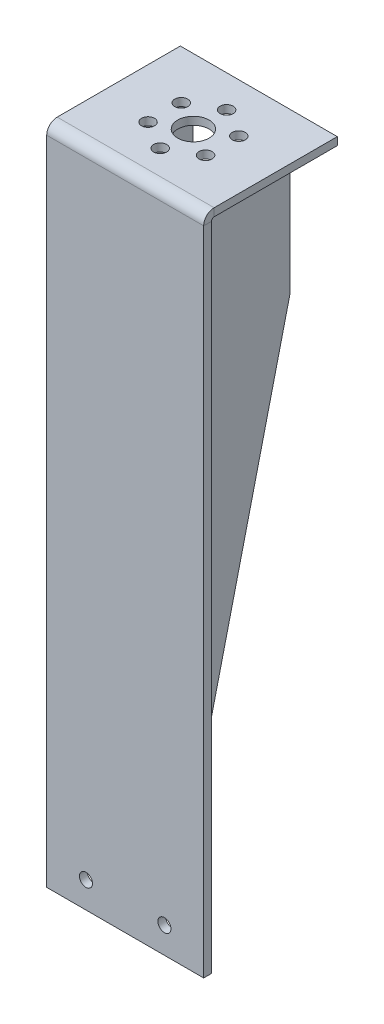
from build123d import *

# Parameters (mm, degrees)
ESBO_O1_W                = 60
ESBO_O1_H                = 300
RESSALTO_EXTRUS_O1_DEPTH = 3
DOBRA_START              = -30
DOBRA_ESBO_ADA1_DEPTH    = 60
DOBRA_ESBO_ADA1_2_DEPTH  = 60
NERVURA1_START           = -20
NERVURA1_DEPTH           = 40
CORTE_EXTRUS_O1_START    = -175
ESBO_O6_W                = 34
ESBO_O6_H                = 40
CORTE_EXTRUS_O1_DEPTH    = 175
ESBO_O7_R                = 2.5
CORTE_EXTRUS_O2_DEPTH    = 3
ESBO_O8_R                = 6
CORTE_EXTRUS_O3_DEPTH    = 3
ESBO_O9_R                = 2.5
CORTE_EXTRUS_O4_DEPTH    = 3
PADR_OCIRCULAR1_COUNT    = 6


# Read off the part's stored shape, not the designer's step: Dobra esboçada1, Nervura1
with BuildPart() as part:
    # Esboço1 → Ressalto-extrusão1 (new body)
    with BuildSketch(Plane.XY):
        Rectangle(ESBO_O1_W, ESBO_O1_H)
    extrude(amount=RESSALTO_EXTRUS_O1_DEPTH)

    # Dobra esboçada1 outline → Dobra esboçada1 (cut)
    with BuildSketch(Plane.YZ.offset(DOBRA_START)):
        with BuildLine():
            ThreePointArc((99, 3), (101.449489743, 2.16227766), (102.872983346, 0))
            Line((102.872983346, 0), (150, 0))
            Line((150, 0), (150, 3))
            Line((150, 3), (99, 3))
        make_face()
    extrude(amount=DOBRA_ESBO_ADA1_DEPTH, mode=Mode.SUBTRACT)

    # Dobra esbo_ada1 2 outline → Dobra esbo_ada1 2 (add)
    with BuildSketch(Plane.YZ.offset(DOBRA_START)):
        with BuildLine():
            Line((100, -1), (100, -48.073009183))
            Line((100, -48.073009183), (103, -48.073009183))
            Line((103, -48.073009183), (103, -1))
            ThreePointArc((103, -1), (102.968118785, -0.49598283), (102.872983346, 0))
            Line((102.872983346, 0), (99, 0))
            ThreePointArc((99, 0), (99.707106781, -0.292893219), (100, -1))
        make_face()
    extrude(amount=DOBRA_ESBO_ADA1_2_DEPTH)

    # Nervura1 outline → Nervura1 (add)
    with BuildSketch(Plane(origin=(0, 0, 0), x_dir=(0, 0, -1), z_dir=(1, 0, 0)).offset(NERVURA1_START)):
        with BuildLine():
            Line((40, 50), (40, 100))
            Line((40, 100), (1, 100))
            ThreePointArc((1, 100), (0.292893219, 99.707106781), (0, 99))
            Line((0, 99), (0, -75))
            Line((0, -75), (10, -75))
            Line((10, -75), (40, 50))
        make_face()
    extrude(amount=NERVURA1_DEPTH)

    # Esboço6 → Corte-extrusão1 (cut)
    with BuildSketch(Plane.XZ.offset(75).offset(CORTE_EXTRUS_O1_START)):
        with Locations((0, -20)):
            Rectangle(ESBO_O6_W, ESBO_O6_H)
    extrude(amount=CORTE_EXTRUS_O1_DEPTH, mode=Mode.SUBTRACT)

    # Esboço7 → Corte-extrusão2 (cut)
    with BuildSketch(Plane.XY.offset(3)):
        with Locations((-15, -140)):
            Circle(ESBO_O7_R)
        with Locations((15, -140)):
            Circle(ESBO_O7_R)
    extrude(amount=-CORTE_EXTRUS_O2_DEPTH, mode=Mode.SUBTRACT)

    # Esboço8 → Corte-extrusão3 (cut)
    with BuildSketch(Plane(origin=(0, 103, 0), x_dir=(1, 0, 0), z_dir=(0, 1, 0))):
        with Locations(Location((0, 23.073009183, 0), (0, 0, 270))):
            Circle(ESBO_O8_R)
    extrude(amount=-CORTE_EXTRUS_O3_DEPTH, mode=Mode.SUBTRACT)

    # Esboço9 → Corte-extrusão4 (cut)
    with BuildSketch(Plane(origin=(0, 103, 0), x_dir=(1, 0, 0), z_dir=(0, 1, 0))):
        with Locations(Location((0, 35.773009183, 0), (0, 0, 270))):
            Circle(ESBO_O9_R)
    corte_extrus_o4 = extrude(amount=-CORTE_EXTRUS_O4_DEPTH, mode=Mode.SUBTRACT)

    # PadrãoCircular1: Corte-extrusão4 ×6 about axis
    padr_ocircular1_axis = Axis((0, 0, -23.073009183), (0, 1, 0))
    for i in range(1, PADR_OCIRCULAR1_COUNT):
        add(corte_extrus_o4.rotate(padr_ocircular1_axis, i * 360 / PADR_OCIRCULAR1_COUNT), mode=Mode.SUBTRACT)


solid = part.part
